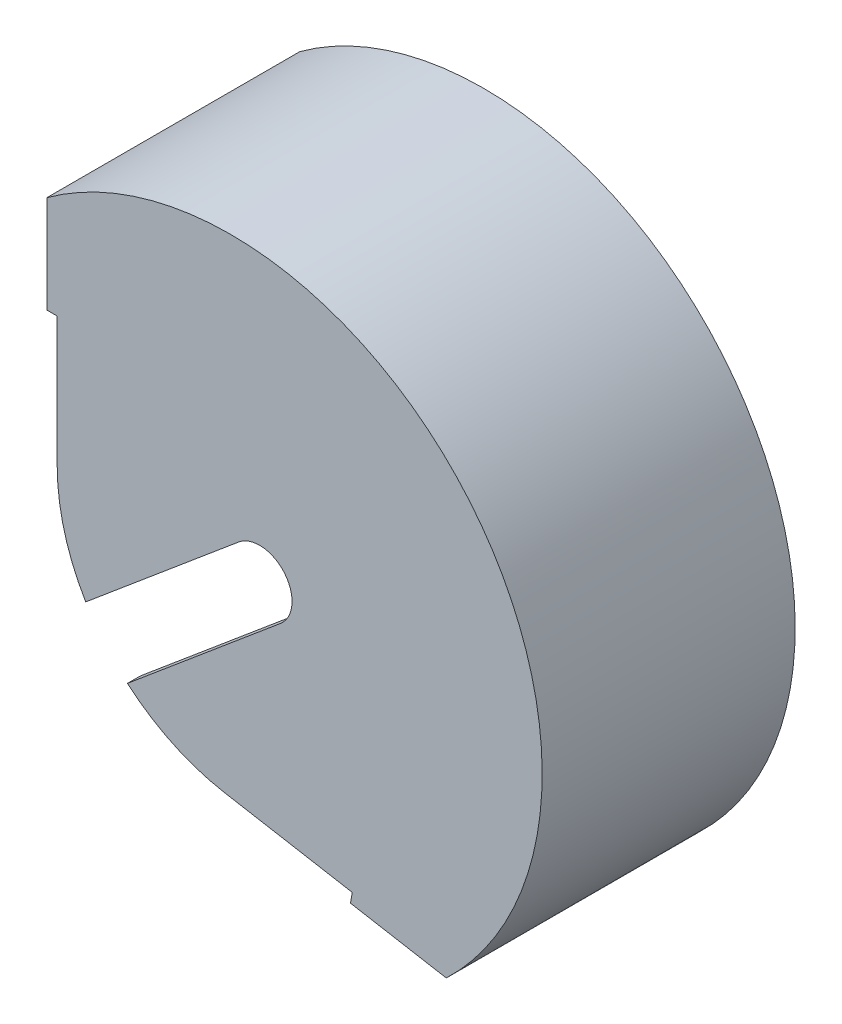
from build123d import *

# Parameters (mm, degrees)
SIDE_DEPTH          = 2.54
COVER_DEPTH         = 44.45
FLYWHEEL_SLIT_REACH = 95.135
MOUNT_HOLES_REACH   = 95.135
SKETCH4_R           = 3.2639


with BuildPart() as part:
    # Sketch1 → Side (new body)
    with BuildSketch(Plane.XY):
        with BuildLine():
            ThreePointArc((-39.624, 0), (-30.353745014, -25.469816246), (-6.880635392, -39.022022405))
            Line((-6.880635392, -39.022022405), (18.133481535, -43.432686118))
            Line((18.133481535, -43.432686118), (17.780628438, -45.433815472))
            Line((17.780628438, -45.433815472), (36.541216132, -48.741813257))
            ThreePointArc((36.541216132, -48.741813257), (41.053420058, 34.447909629), (-41.656, 44.45))
            Line((-41.656, 44.45), (-41.656, 25.4))
            Line((-41.656, 25.4), (-39.624, 25.4))
            Line((-39.624, 25.4), (-39.624, 0))
        make_face()
    side = extrude(amount=SIDE_DEPTH)

    # Sketch2 → Cover (add)
    with BuildSketch(Plane.XY.offset(2.54)):
        with BuildLine():
            Line((-41.656, 42.400565706), (-40.15552705, 42.400565706))
            ThreePointArc((-40.15552705, 42.400565706), (39.107667173, 32.815229101), (34.783471744, -46.908255332))
            Line((34.783471744, -46.908255332), (34.52291735, -48.385932726))
            Line((34.52291735, -48.385932726), (36.541216132, -48.741813257))
            ThreePointArc((36.541216132, -48.741813257), (41.053420058, 34.447909629), (-41.656, 44.45))
            Line((-41.656, 44.45), (-41.656, 42.400565706))
        make_face()
    extrude(amount=COVER_DEPTH)

    # Mirror1: Side across plane
    add(side.mirror(Plane.XY.offset(24.765)))

    # Sketch3 → Flywheel slit (cut, up to next)
    with BuildSketch(Plane.XY.offset(49.53), mode=Mode.PRIVATE) as flywheel_slit_sk1:
        with BuildLine():
            Line((-4.081701322, 4.864382214), (-37.159500375, -22.891186772))
            Line((-37.159500375, -22.891186772), (-28.996097732, -32.6199512))
            Line((-28.996097732, -32.6199512), (4.081701322, -4.864382214))
            ThreePointArc((4.081701322, -4.864382214), (4.864382214, 4.081701322), (-4.081701322, 4.864382214))
        make_face()
    flywheel_slit_tool1 = extrude(flywheel_slit_sk1.sketch, amount=-FLYWHEEL_SLIT_REACH, mode=Mode.PRIVATE) & part.part
    add(flywheel_slit_tool1.solids().sort_by_distance((-14.612688, -12.261501, 49.53))[0], mode=Mode.SUBTRACT)

    # Sketch4 → Mount holes (cut, up to next)
    with BuildSketch(Plane(origin=(0, 0, 0), x_dir=(-1, 0, 0), z_dir=(0, 0, -1)), mode=Mode.PRIVATE) as mount_holes_sk1:
        with Locations((-2.116217682, -33.531680079)):
            Circle(SKETCH4_R)
    mount_holes_tool1 = extrude(mount_holes_sk1.sketch, amount=-MOUNT_HOLES_REACH, mode=Mode.PRIVATE) & part.part
    # Sketch4 → Mount holes (cut, up to next)
    with BuildSketch(Plane(origin=(0, 0, 0), x_dir=(-1, 0, 0), z_dir=(0, 0, -1)), mode=Mode.PRIVATE) as mount_holes_sk2:
        with Locations((33.277492898, 10.173950581)):
            Circle(SKETCH4_R)
    mount_holes_tool2 = extrude(mount_holes_sk2.sketch, amount=-MOUNT_HOLES_REACH, mode=Mode.PRIVATE) & part.part
    add(mount_holes_tool1.solids().sort_by_distance((2.116218, -33.53168, 0))[0], mode=Mode.SUBTRACT)
    add(mount_holes_tool2.solids().sort_by_distance((-33.277493, 10.173951, 0))[0], mode=Mode.SUBTRACT)


solid = part.part
